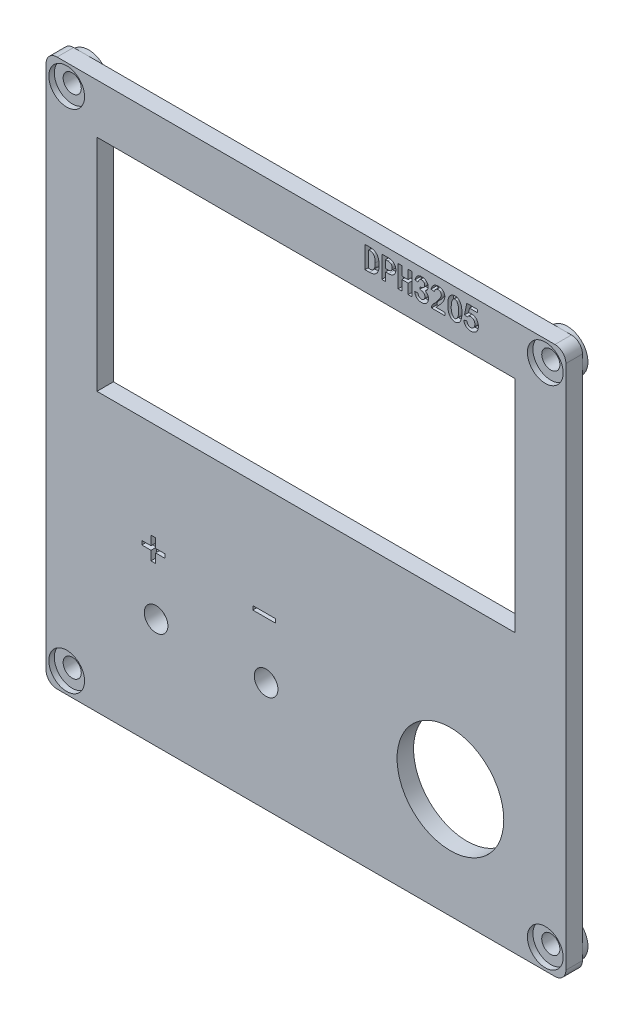
from build123d import *

# Parameters (mm, degrees)
SKETCH_1_R          = 2.15
SKETCH_1_R_2        = 9.7
SKETCH_1_W          = 76
SKETCH_1_H          = 40
EXTRUDE_1_DEPTH     = 3
SKETCH_2_W          = 4.137797811
SKETCH_2_H          = 0.710882164
CUT_EXTRUDE_1_DEPTH = 1
SKETCH_3_R          = 3.75
EXTRUDE_2_DEPTH     = 1
SKETCH_4_R          = 1.65
CUT_EXTRUDE_2_DEPTH = 69.72863319
SKETCH_5_R          = 3.25
CUT_EXTRUDE_3_DEPTH = 1


with BuildPart() as part:
    # 草图1 → 凸台-拉伸1 (new body)
    with BuildSketch(Plane.XY):
        with BuildLine():
            Line((-45.25, -49.75), (45.25, -49.75))
            ThreePointArc((45.25, -49.75), (46.664213562, -49.164213562), (47.25, -47.75))
            Line((47.25, -47.75), (47.25, 47.75))
            ThreePointArc((47.25, 47.75), (46.664213562, 49.164213562), (45.25, 49.75))
            Line((45.25, 49.75), (-45.25, 49.75))
            ThreePointArc((-45.25, 49.75), (-46.664213562, 49.164213562), (-47.25, 47.75))
            Line((-47.25, 47.75), (-47.25, -47.75))
            ThreePointArc((-47.25, -47.75), (-46.664213562, -49.164213562), (-45.25, -49.75))
        make_face()
        with Locations((-27.25, -29.75)):
            Circle(SKETCH_1_R, mode=Mode.SUBTRACT)
        with Locations((-7.25, -29.75)):
            Circle(SKETCH_1_R, mode=Mode.SUBTRACT)
        with Locations((26.25, -29.75)):
            Circle(SKETCH_1_R_2, mode=Mode.SUBTRACT)
        with Locations((0, 20.75)):
            Rectangle(SKETCH_1_W, SKETCH_1_H, mode=Mode.SUBTRACT)
    extrude(amount=EXTRUDE_1_DEPTH)

    # 草图2 → 切除-拉伸1 (cut)
    # profile 1 of 9: a face of its own
    with BuildSketch(Plane.XY.offset(3)):
        with BuildLine():
            add(Edge.make_bspline(
                [(25.773758367, 46.505328525), (25.775969709, 46.555147397), (25.78028274, 46.652314757), (25.792643094, 46.793720271), (25.807811887, 46.927506481), (25.827234123, 47.053324063), (25.851527714, 47.171241352), (25.878621466, 47.281438374), (25.910258204, 47.383865297), (25.958071695, 47.508706729), (26.028073633, 47.65355075), (26.129838409, 47.812915081), (26.249373739, 47.956068284), (26.361427404, 48.062917846), (26.459859694, 48.137856014), (26.539050196, 48.187020162), (26.623405238, 48.228229653), (26.712377362, 48.261567945), (26.805561652, 48.288572609), (26.903860095, 48.307274167), (27.006946072, 48.318309436), (27.113386993, 48.321492741), (27.220523142, 48.317648244), (27.325149694, 48.299647225), (27.426333108, 48.272415435), (27.523724912, 48.23356352), (27.617020335, 48.183418171), (27.705974966, 48.121730736), (27.791206089, 48.049115977), (27.872032503, 47.966443402), (27.946529479, 47.875359078), (28.017067085, 47.780694437), (28.077305495, 47.679174353), (28.133000891, 47.574821135), (28.179768948, 47.464746766), (28.221878796, 47.35086003), (28.253542284, 47.230979038), (28.289719702, 47.063498275), (28.319887216, 46.841890265), (28.342221295, 46.562137879), (28.348624342, 46.264320492), (28.340737918, 46.006845206), (28.326531135, 45.798207482), (28.310482089, 45.646366882), (28.288556953, 45.501864688), (28.263873867, 45.363943398), (28.230439156, 45.23364898), (28.193993631, 45.10964595), (28.152076056, 44.992861191), (28.104678237, 44.883230969), (28.05213051, 44.780496547), (27.990371895, 44.686222656), (27.921958927, 44.599748852), (27.846666976, 44.520638651), (27.763766457, 44.449935675), (27.673294119, 44.387250387), (27.575816856, 44.332224167), (27.472861073, 44.285167849), (27.36614023, 44.248577337), (27.258979427, 44.222399489), (27.152163404, 44.208670953), (27.045937061, 44.20572628), (26.940309689, 44.215496424), (26.835177704, 44.2361569), (26.731193601, 44.269237737), (26.629037036, 44.312736289), (26.531987609, 44.365043186), (26.440383588, 44.420585111), (26.356701959, 44.480730209), (26.28118794, 44.545618287), (26.211755205, 44.612929848), (26.151672362, 44.686044277), (26.097640965, 44.762044244), (26.039569231, 44.870531569), (25.976248246, 45.009582451), (25.912056748, 45.180745354), (25.85808123, 45.35509476), (25.824800149, 45.504726549), (25.802464788, 45.629516835), (25.790263573, 45.731610409), (25.779644583, 45.841503623), (25.773230384, 45.959230052), (25.768976816, 46.08460339), (25.767102405, 46.217713298), (25.769107518, 46.358830641), (25.772177634, 46.455536739), (25.773758367, 46.505328525)],
                knots=[0, 0, 0, 0, 1.155683737, 2.254060208, 3.289083543, 4.275996313, 5.203501349, 6.078654409, 6.905254226, 7.686259293, 9.175480835, 10.625362805, 12.057229327, 13.488373587, 14.203415217, 14.921281653, 15.645099004, 16.375632236, 17.120922195, 17.891035316, 18.691651653, 19.521200253, 20.357904477, 21.171386448, 21.975949703, 22.782724614, 23.595854961, 24.425642192, 25.286833663, 26.187407587, 27.101221321, 28.01267284, 28.920448357, 29.83426209, 30.752254981, 31.690137756, 32.645956503, 33.622989927, 35.660431351, 37.823041574, 40.125301952, 42.560703798, 43.790833543, 44.971618186, 46.098231705, 47.178004829, 48.217249088, 49.214075701, 50.172927633, 51.090920525, 51.980953586, 52.843803822, 53.698431003, 54.533503556, 55.370943622, 56.21918914, 57.080584939, 57.962199368, 58.839009869, 59.691678548, 60.51441043, 61.330511274, 62.149625556, 62.967853103, 63.80909348, 64.673955469, 65.537417366, 66.362178841, 67.155619074, 67.922554923, 68.668316995, 69.393591698, 70.113049857, 70.825595159, 72.241347001, 73.651946307, 75.059845092, 76.467821999, 77.201720101, 77.997292311, 78.850038385, 79.760306499, 80.729291287, 81.757490875, 82.845382708, 84, 84, 84, 84], degree=3))
        make_face()
        with BuildLine():
            add(Edge.make_bspline(
                [(26.41509771, 46.636687186), (26.410165106, 46.585487328), (26.400476242, 46.484918041), (26.392201304, 46.33572282), (26.387876527, 46.19080666), (26.392312663, 46.050219507), (26.398966837, 45.913761834), (26.414043524, 45.782047153), (26.433830158, 45.654311536), (26.458059753, 45.531807031), (26.488276758, 45.416206016), (26.521468133, 45.309323189), (26.557380799, 45.211249156), (26.59736876, 45.123027902), (26.641451804, 45.044114897), (26.688547916, 44.97459924), (26.738281787, 44.913312011), (26.792544689, 44.862927743), (26.848364897, 44.821316698), (26.905215929, 44.789259165), (26.962359574, 44.766437831), (27.019979655, 44.753170966), (27.078314302, 44.749657478), (27.136986281, 44.756149113), (27.196285597, 44.770529558), (27.254563841, 44.796176626), (27.311436858, 44.829485722), (27.366424787, 44.869793435), (27.415834334, 44.919582698), (27.46269417, 44.97568869), (27.50553198, 45.039712753), (27.544919173, 45.11091034), (27.580297618, 45.189959669), (27.622276756, 45.306268798), (27.665555628, 45.4617722), (27.703450078, 45.656969482), (27.725582549, 45.861453971), (27.731834948, 46.071718898), (27.729599297, 46.281590487), (27.722491719, 46.484800812), (27.712611199, 46.678373121), (27.697920649, 46.862437574), (27.674674905, 47.037543403), (27.634162425, 47.202873635), (27.577482221, 47.3577924), (27.517488775, 47.478120074), (27.462791153, 47.56536967), (27.419765216, 47.623154318), (27.37345661, 47.671545013), (27.325938432, 47.713322683), (27.275020824, 47.745046871), (27.221804213, 47.768627401), (27.166358108, 47.784438549), (27.108992325, 47.791110861), (27.051120902, 47.789457516), (26.994094684, 47.77906452), (26.938124506, 47.759887967), (26.883859036, 47.730891663), (26.830409045, 47.693569323), (26.77795796, 47.647879341), (26.727069625, 47.592989371), (26.677356181, 47.529473969), (26.629533656, 47.456150099), (26.587202958, 47.371127633), (26.547238137, 47.275897154), (26.514222271, 47.168769499), (26.48132146, 47.051798414), (26.456054589, 46.922991706), (26.432189797, 46.783682654), (26.42092889, 46.686836533), (26.41509771, 46.636687186)],
                knots=[0, 0, 0, 0, 1.452167118, 2.852418281, 4.218396657, 5.543984443, 6.822765002, 8.074713207, 9.284974616, 10.471920825, 11.598846593, 12.656922723, 13.631044256, 14.5458853, 15.388812111, 16.179953707, 16.914519434, 17.61197034, 18.264888641, 18.876285569, 19.449485096, 19.996394829, 20.5387489, 21.091123116, 21.657504393, 22.254856762, 22.881287043, 23.51641241, 24.173517405, 24.856351225, 25.578003657, 26.344795291, 27.151303469, 28.020468383, 29.834110771, 31.702512638, 33.62906866, 35.634339229, 37.638355807, 39.554512999, 41.375197988, 43.110520322, 44.767505055, 46.356911141, 47.906083104, 49.416608493, 50.142950543, 50.812019548, 51.446476334, 52.031067659, 52.593805832, 53.132839029, 53.670052187, 54.215287947, 54.756919201, 55.298972215, 55.845822252, 56.420500712, 57.030186539, 57.683154838, 58.380605745, 59.14033988, 59.958423015, 60.847419337, 61.818318184, 62.871135914, 64.010020701, 65.247701822, 66.574791078, 68, 68, 68, 68], degree=3))
        make_face(mode=Mode.SUBTRACT)
    # profile 2 of 9: a face of its own
    with BuildSketch(Plane.XY.offset(3)):
        with BuildLine():
            add(Edge.make_bspline(
                [(13.285241518, 46.240035544), (13.283682115, 46.155285074), (13.280668639, 45.991508663), (13.259812953, 45.754935684), (13.22273555, 45.536896219), (13.173073162, 45.336448602), (13.106910902, 45.154244072), (13.026293325, 44.99020749), (12.931485953, 44.843811701), (12.820659608, 44.716773682), (12.696286472, 44.607755406), (12.563161093, 44.51142845), (12.418082939, 44.431513034), (12.263072893, 44.364668391), (12.096315889, 44.314857921), (11.919536629, 44.27743285), (11.731770227, 44.25631633), (11.603099923, 44.25321417), (11.537226923, 44.251626014)],
                knots=[0, 0, 0, 0, 1.342144575, 2.593633054, 3.756717374, 4.841651051, 5.859627, 6.82036316, 7.730462365, 8.613865072, 9.480661094, 10.344703869, 11.211025818, 12.098326216, 13.012995588, 13.962311034, 14.956801371, 16, 16, 16, 16], degree=3))
            Line((11.537226923, 44.251626014), (10.708722952, 44.251626014))
            Line((10.708722952, 44.251626014), (10.708722952, 48.251626014))
            Line((10.708722952, 48.251626014), (11.537226923, 48.251626014))
            add(Edge.make_bspline(
                [(11.537226923, 48.251626014), (11.610260238, 48.250152136), (11.751820851, 48.247295317), (11.956676316, 48.225090944), (12.146366, 48.187602682), (12.320852916, 48.135495871), (12.480414228, 48.068439758), (12.624969787, 47.985881101), (12.753924652, 47.887279685), (12.867888749, 47.773205371), (12.967800644, 47.642938015), (13.052548693, 47.494253787), (13.12560502, 47.328943544), (13.184776317, 47.145345933), (13.229402626, 46.944031425), (13.26162354, 46.725110145), (13.281461748, 46.48852175), (13.283952355, 46.324786503), (13.285241518, 46.240035544)],
                knots=[0, 0, 0, 0, 1.139218849, 2.20815003, 3.209846182, 4.151949686, 5.044228713, 5.904257272, 6.741881979, 7.569029454, 8.412913495, 9.295104618, 10.232584117, 11.227981957, 12.299195142, 13.445861256, 14.677952907, 16, 16, 16, 16], degree=3))
        make_face()
        with BuildLine():
            add(Edge.make_bspline(
                [(12.574359354, 46.240035544), (12.573549734, 46.306164867), (12.57199564, 46.433102252), (12.559864164, 46.615622808), (12.540805925, 46.782578834), (12.512892596, 46.934201333), (12.476157586, 47.070344041), (12.4320268, 47.191100107), (12.379864709, 47.296547246), (12.318068244, 47.38635609), (12.247965414, 47.46285518), (12.171239802, 47.529860091), (12.08537177, 47.586000977), (11.991202509, 47.631481211), (11.88917519, 47.666818632), (11.779119259, 47.691264389), (11.66103836, 47.707233513), (11.579351112, 47.708978836), (11.537226923, 47.709878858)],
                knots=[0, 0, 0, 0, 1.535002912, 2.946487986, 4.244348877, 5.43397676, 6.521824758, 7.513996585, 8.414230777, 9.245329631, 10.035428857, 10.817273383, 11.604069902, 12.409274804, 13.239177928, 14.104616871, 15.02259556, 16, 16, 16, 16], degree=3))
            Line((11.537226923, 47.709878858), (11.396424175, 47.709878858))
            Line((11.396424175, 47.709878858), (11.396424175, 44.79337317))
            Line((11.396424175, 44.79337317), (11.537226923, 44.79337317))
            add(Edge.make_bspline(
                [(11.537226923, 44.79337317), (11.579344288, 44.794347045), (11.66098203, 44.796234747), (11.779335594, 44.811216162), (11.889744031, 44.834562761), (11.99159878, 44.869176125), (12.085536319, 44.913032061), (12.17094767, 44.967647772), (12.248752448, 45.031374777), (12.318834537, 45.105681961), (12.380934193, 45.193019115), (12.432859029, 45.296288209), (12.476092639, 45.41526561), (12.513071508, 45.549530777), (12.540773279, 45.700073783), (12.559878509, 45.86615988), (12.571993635, 46.047827474), (12.573548952, 46.174192627), (12.574359354, 46.240035544)],
                knots=[0, 0, 0, 0, 0.985268004, 1.909783609, 2.787259994, 3.621665962, 4.421521346, 5.207376589, 5.987676396, 6.769383106, 7.590706022, 8.48624322, 9.465232296, 10.548914331, 11.741531606, 13.043184133, 14.459342799, 16, 16, 16, 16], degree=3))
        make_face(mode=Mode.SUBTRACT)
    # profile 3 of 9: a face of its own
    with BuildSketch(Plane.XY.offset(3)):
        with BuildLine():
            add(Edge.make_bspline(
                [(16.329671653, 47.013592101), (16.328806119, 46.968605593), (16.327107643, 46.880326519), (16.310133088, 46.751375346), (16.284075298, 46.628724295), (16.246005839, 46.513164938), (16.197560034, 46.404236552), (16.139240793, 46.301371071), (16.06887224, 46.205508952), (15.988432171, 46.116506701), (15.898521193, 46.035598708), (15.798916655, 45.965374644), (15.68972746, 45.906889173), (15.571635008, 45.858986945), (15.444923381, 45.8209571), (15.309138478, 45.794921736), (15.164754445, 45.778066366), (15.065358552, 45.77640862), (15.01436794, 45.775558188)],
                knots=[0, 0, 0, 0, 1.055941234, 2.072121589, 3.048957332, 3.996857081, 4.923552649, 5.844699312, 6.768221172, 7.710385292, 8.657546142, 9.602916946, 10.565193964, 11.559900134, 12.591170482, 13.666713964, 14.803012066, 16, 16, 16, 16], degree=3))
            Line((15.01436794, 45.775558188), (14.464035251, 45.775558188))
            Line((14.464035251, 45.775558188), (14.464035251, 44.251626014))
            Line((14.464035251, 44.251626014), (13.776334027, 44.251626014))
            Line((13.776334027, 44.251626014), (13.776334027, 48.251626014))
            Line((13.776334027, 48.251626014), (15.01436794, 48.251626014))
            add(Edge.make_bspline(
                [(15.01436794, 48.251626014), (15.065358459, 48.250775176), (15.164754169, 48.24911664), (15.309139492, 48.232266867), (15.444919861, 48.206211821), (15.571393321, 48.16832709), (15.689323223, 48.120264803), (15.797824013, 48.060813767), (15.897699579, 47.990787048), (15.987547151, 47.909793342), (16.068081752, 47.820858618), (16.138225908, 47.724699681), (16.197735386, 47.622354254), (16.245939904, 47.513123531), (16.284100665, 47.397612587), (16.310039712, 47.275221892), (16.327161825, 47.146580039), (16.3288226, 47.058580774), (16.329671653, 47.013592101)],
                knots=[0, 0, 0, 0, 1.197461093, 2.334208364, 3.410176999, 4.441854999, 5.43073401, 6.396602736, 7.342347237, 8.289882492, 9.232419041, 10.156305961, 11.081170954, 12.008232837, 12.956507283, 13.93372916, 14.943641362, 16, 16, 16, 16], degree=3))
        make_face()
        with BuildLine():
            add(Edge.make_bspline(
                [(15.64197043, 47.013592101), (15.64167773, 47.045959339), (15.641114234, 47.108271506), (15.631250111, 47.197481465), (15.616825916, 47.278714862), (15.597665845, 47.352440408), (15.571114529, 47.417980744), (15.538387259, 47.475120916), (15.50023693, 47.524371351), (15.455388593, 47.565178288), (15.40481494, 47.600096416), (15.347417164, 47.628677232), (15.284866641, 47.654842386), (15.215494445, 47.675363293), (15.139850619, 47.690364977), (15.058129368, 47.701417981), (14.970127036, 47.708352746), (14.909351534, 47.709357961), (14.877857959, 47.709878858)],
                knots=[0, 0, 0, 0, 1.287087184, 2.477851002, 3.56551051, 4.568137571, 5.502703185, 6.369845782, 7.180743627, 7.970419851, 8.772637866, 9.617977299, 10.516617182, 11.467615524, 12.490341929, 13.582105939, 14.747058877, 16, 16, 16, 16], degree=3))
            Line((14.877857959, 47.709878858), (14.464035251, 47.709878858))
            Line((14.464035251, 47.709878858), (14.464035251, 46.318163897))
            Line((14.464035251, 46.318163897), (14.877857959, 46.318163897))
            add(Edge.make_bspline(
                [(14.877857959, 46.318163897), (14.909350441, 46.318695819), (14.970409155, 46.319727126), (15.058709899, 46.3265609), (15.140696737, 46.337710851), (15.21639406, 46.352580653), (15.285484277, 46.373499153), (15.348313312, 46.398061846), (15.40494137, 46.427407508), (15.455410119, 46.461960691), (15.500231043, 46.502825219), (15.538388973, 46.552059685), (15.571114017, 46.609204533), (15.597665998, 46.674743473), (15.61682587, 46.748469436), (15.631250125, 46.829702708), (15.64111423, 46.918912704), (15.641677728, 46.981224866), (15.64197043, 47.013592101)],
                knots=[0, 0, 0, 0, 1.253177668, 2.4297043, 3.521674426, 4.544593913, 5.495771796, 6.390314524, 7.225705931, 8.028075398, 8.817900706, 9.628951643, 10.496257949, 11.431000001, 12.433816351, 13.5216812, 14.712669824, 16, 16, 16, 16], degree=3))
        make_face(mode=Mode.SUBTRACT)
    # profile 4 of 9: a face of its own
    with BuildSketch(Plane.XY.offset(3)):
        Polygon((19.260772748, 44.251626014), (18.573071524, 44.251626014), (18.573071524, 46.07175909), (17.440639672, 46.07175909), (17.440639672, 44.251626014), (16.752938449, 44.251626014), (16.752938449, 48.251626014), (17.440639672, 48.251626014), (17.440639672, 46.613506246), (18.573071524, 46.613506246), (18.573071524, 48.251626014), (19.260772748, 48.251626014), align=None)
    # profile 5 of 9: a face of its own
    with BuildSketch(Plane.XY.offset(3)):
        with BuildLine():
            Line((19.751865257, 45.352291393), (20.303915053, 45.430419746))
            add(Edge.make_bspline(
                [(20.303915053, 45.430419746), (20.322527897, 45.376460329), (20.357887277, 45.273952002), (20.426144056, 45.133940589), (20.503365858, 45.015634424), (20.575355936, 44.931661448), (20.638782126, 44.877911171), (20.687663423, 44.84326029), (20.739493325, 44.814707903), (20.794065521, 44.792432205), (20.851246549, 44.775092948), (20.911027357, 44.763102805), (20.973732907, 44.757073049), (21.037815362, 44.75726895), (21.102064811, 44.762785539), (21.164109097, 44.776071041), (21.223704826, 44.794546264), (21.279697156, 44.820709477), (21.33275333, 44.852822425), (21.382775849, 44.891533337), (21.429027941, 44.937652945), (21.472498497, 44.988700856), (21.51171804, 45.044064122), (21.54541632, 45.102277643), (21.572000201, 45.163263993), (21.593649768, 45.2257636), (21.60910437, 45.290469168), (21.618573836, 45.356861999), (21.621930306, 45.425250114), (21.619382033, 45.49476754), (21.610881373, 45.563391392), (21.597247592, 45.628923734), (21.578360894, 45.690593788), (21.553549558, 45.74831901), (21.522212256, 45.802064303), (21.485296973, 45.851831342), (21.4429354, 45.897532753), (21.394923886, 45.939749217), (21.338639819, 45.977614843), (21.274167091, 46.014175221), (21.198779264, 46.045817155), (21.114860117, 46.077189382), (21.020825599, 46.104085407), (20.917696519, 46.128905767), (20.804852417, 46.151317002), (20.72608998, 46.163365679), (20.685112735, 46.16963417)],
                knots=[0, 0, 0, 0, 2.21924101, 4.215958907, 6.040992817, 7.7053072, 8.495104242, 9.27040691, 10.032811151, 10.791629887, 11.559461714, 12.354265444, 13.159682002, 14.005854253, 14.844521828, 15.663370554, 16.46971005, 17.266772081, 18.061107775, 18.878441235, 19.720869505, 20.597620065, 21.484212586, 22.356995289, 23.209370964, 24.068482601, 24.927233434, 25.793243368, 26.673943911, 27.587530034, 28.496218265, 29.360938961, 30.188521517, 31.001368487, 31.799596098, 32.603472073, 33.407116705, 34.21988742, 35.084608115, 36.041665591, 37.098677481, 38.261085067, 39.525891865, 40.900414571, 42.387397877, 44, 44, 44, 44], degree=3))
            Line((20.685112735, 46.16963417), (20.685112735, 46.562851599))
            add(Edge.make_bspline(
                [(20.685112735, 46.562851599), (20.725812533, 46.566951134), (20.804345719, 46.574861483), (20.916916171, 46.594044211), (21.020171393, 46.616955759), (21.113855562, 46.644024174), (21.197941264, 46.676026146), (21.272699478, 46.711579511), (21.338296413, 46.751930391), (21.393327612, 46.798257558), (21.441591196, 46.847206094), (21.480534653, 46.901225645), (21.515224357, 46.957060153), (21.540391325, 47.017565156), (21.559798937, 47.08106698), (21.571489359, 47.147955425), (21.576667948, 47.218421336), (21.57470773, 47.290830965), (21.566948359, 47.362948577), (21.55007106, 47.430948714), (21.528284025, 47.494545431), (21.497753116, 47.55240176), (21.460574356, 47.605243257), (21.416324173, 47.653163772), (21.364425562, 47.694916823), (21.307089514, 47.731659985), (21.246309478, 47.762096153), (21.183795552, 47.785397606), (21.121233185, 47.802352932), (21.057641364, 47.809699831), (20.994085545, 47.810520265), (20.92965385, 47.804959816), (20.865475333, 47.789427564), (20.800038032, 47.768838572), (20.735804957, 47.735465955), (20.67276126, 47.689076343), (20.613477454, 47.627298757), (20.555378599, 47.552476926), (20.500361872, 47.463653434), (20.445795024, 47.361451425), (20.393945616, 47.245129984), (20.362965719, 47.161736455), (20.34684272, 47.118335608)],
                knots=[0, 0, 0, 0, 1.544655138, 2.980523068, 4.310085624, 5.538041238, 6.660247671, 7.704521267, 8.661264608, 9.559490368, 10.415691744, 11.250192615, 12.06957472, 12.892798034, 13.716943409, 14.573554092, 15.451518492, 16.381382685, 17.306522728, 18.184819779, 19.022465106, 19.839562419, 20.646298093, 21.457079029, 22.294445327, 23.155002605, 24.02514668, 24.85635064, 25.671730158, 26.466794538, 27.266766995, 28.070237254, 28.901511498, 29.756073687, 30.655274543, 31.621678213, 32.699429876, 33.87785843, 35.19439462, 36.640317884, 38.251506453, 40, 40, 40, 40], degree=3))
            Line((20.34684272, 47.118335608), (19.797368584, 47.196463962))
            add(Edge.make_bspline(
                [(19.797368584, 47.196463962), (19.809239482, 47.235816237), (19.832566992, 47.313147415), (19.874227902, 47.424250762), (19.917812171, 47.529602096), (19.965103325, 47.628469239), (20.015638403, 47.721458083), (20.06997827, 47.808003584), (20.126165903, 47.889441874), (20.187759361, 47.963403573), (20.252665616, 48.03205765), (20.324427508, 48.092427734), (20.402334197, 48.144965642), (20.485631487, 48.190512521), (20.574717933, 48.228616914), (20.669755236, 48.258331904), (20.770432139, 48.281800881), (20.875918338, 48.296474854), (20.982580733, 48.3051184), (21.087809443, 48.30663585), (21.190210064, 48.302706107), (21.28977884, 48.291550541), (21.386256282, 48.273662), (21.479338715, 48.248344895), (21.569889341, 48.217593356), (21.656949772, 48.180117772), (21.738895303, 48.136477806), (21.815187368, 48.088252857), (21.884655518, 48.035034111), (21.947965698, 47.977345495), (22.004028953, 47.914312176), (22.053320914, 47.846180064), (22.095135635, 47.772753509), (22.131419489, 47.695640996), (22.16003099, 47.61527674), (22.183194708, 47.533088783), (22.196972044, 47.448684641), (22.206256304, 47.362969551), (22.206607991, 47.275344026), (22.200743541, 47.186370711), (22.18739375, 47.095487764), (22.168388673, 47.00362617), (22.140317229, 46.912388801), (22.101650354, 46.824222569), (22.051284759, 46.740649056), (21.990529759, 46.661189674), (21.91963906, 46.585446861), (21.838673163, 46.513276581), (21.747011889, 46.444900285), (21.680250055, 46.4043288), (21.64583392, 46.383413951)],
                knots=[0, 0, 0, 0, 1.264664845, 2.485193632, 3.649815651, 4.772554787, 5.8564488, 6.904873161, 7.916470085, 8.89869285, 9.86418825, 10.820480558, 11.778069864, 12.751606364, 13.738084608, 14.754768136, 15.81232734, 16.915902724, 18.029136064, 19.103794268, 20.152810375, 21.180875043, 22.184503936, 23.16940822, 24.147039655, 25.125424593, 26.08285187, 27.001536872, 27.899944066, 28.772641487, 29.633525806, 30.491521848, 31.355643938, 32.230383382, 33.110780052, 33.97826197, 34.85428633, 35.739428161, 36.629028292, 37.54707979, 38.481255219, 39.453795203, 40.431585318, 41.413492129, 42.408894417, 43.427064688, 44.486456052, 45.596758908, 46.761114469, 48, 48, 48, 48], degree=3))
            add(Edge.make_bspline(
                [(21.64583392, 46.383413951), (21.670582827, 46.373146404), (21.719451451, 46.35287234), (21.789976856, 46.317014014), (21.854754808, 46.273243025), (21.917436744, 46.226205881), (21.975254215, 46.17283043), (22.030409082, 46.114814186), (22.080301223, 46.0505461), (22.127019597, 45.981749988), (22.168673238, 45.908150229), (22.202109327, 45.828216535), (22.228647467, 45.743451125), (22.247638347, 45.653467999), (22.258328344, 45.558620934), (22.262858503, 45.458767222), (22.25877886, 45.353801374), (22.248986298, 45.245310861), (22.231005052, 45.136385427), (22.201194171, 45.03105872), (22.162946892, 44.930041543), (22.113263088, 44.834330754), (22.054854888, 44.743065268), (21.98667074, 44.656522955), (21.907725487, 44.575952013), (21.821162666, 44.499852774), (21.72707686, 44.432280678), (21.630380815, 44.371548198), (21.529744081, 44.321247441), (21.425867751, 44.281169371), (21.31913788, 44.249699544), (21.209167193, 44.22965671), (21.09640518, 44.2169563), (20.981497081, 44.216051105), (20.867247772, 44.222434116), (20.756239223, 44.2381919), (20.649251722, 44.260968087), (20.546902545, 44.293148588), (20.448368539, 44.332387319), (20.354600439, 44.38120836), (20.264070949, 44.436524635), (20.178982958, 44.501542883), (20.098276542, 44.574106071), (20.026465517, 44.65802394), (19.961630749, 44.750692786), (19.904001004, 44.852378721), (19.853959626, 44.9638923), (19.812722177, 45.085154851), (19.77675534, 45.215171784), (19.76030962, 45.305771351), (19.751865257, 45.352291393)],
                knots=[0, 0, 0, 0, 0.768138437, 1.516748496, 2.263152186, 3.006528408, 3.761540595, 4.516106847, 5.299044825, 6.090959292, 6.899030075, 7.718886061, 8.570043758, 9.442217001, 10.351016586, 11.303647327, 12.305160512, 13.359969178, 14.42557193, 15.464691966, 16.493198161, 17.516980995, 18.550254108, 19.59586457, 20.669303552, 21.779974798, 22.895936785, 23.986546903, 25.050632422, 26.115666464, 27.175060169, 28.23550182, 29.31644003, 30.424198195, 31.525587691, 32.594249943, 33.6354733, 34.657940217, 35.666553097, 36.671990709, 37.685198356, 38.704235937, 39.737964997, 40.790761429, 41.862851258, 42.976186133, 44.136653187, 45.361383937, 46.645153232, 48, 48, 48, 48], degree=3))
        make_face()
    # profile 6 of 9: a face of its own
    with BuildSketch(Plane.XY.offset(3)):
        with BuildLine():
            add(Edge.make_bspline(
                [(22.819476332, 44.423336681), (22.822214596, 44.453206146), (22.82768775, 44.512908261), (22.848307906, 44.60012257), (22.875620948, 44.685491813), (22.912698547, 44.767712356), (22.958646447, 44.847222256), (23.013108507, 44.923825472), (23.075923691, 44.998043266), (23.1489916, 45.069181292), (23.228255981, 45.143518527), (23.31093372, 45.227492165), (23.397949564, 45.320796087), (23.489769179, 45.423035901), (23.586392017, 45.534238171), (23.68714147, 45.654978067), (23.792926502, 45.785003072), (23.901180239, 45.920670206), (24.006603986, 46.057129952), (24.104204284, 46.188428094), (24.192990531, 46.310583868), (24.270506003, 46.425355104), (24.338268838, 46.531622594), (24.396957347, 46.629224789), (24.445440054, 46.718449284), (24.494689949, 46.823686839), (24.540304453, 46.944657022), (24.578130085, 47.080422898), (24.593895422, 47.204917282), (24.588615055, 47.318209287), (24.562715796, 47.420133148), (24.522585294, 47.51363447), (24.462488763, 47.595746412), (24.389061934, 47.667393581), (24.305512395, 47.725504742), (24.214292043, 47.765494672), (24.117943114, 47.784708338), (24.018303963, 47.782931083), (23.918081324, 47.764343267), (23.818007454, 47.731349927), (23.719570869, 47.682286952), (23.63958032, 47.630038284), (23.576841643, 47.579774072), (23.532247319, 47.533217894), (23.488555493, 47.481285838), (23.446984623, 47.422082699), (23.407758741, 47.355891167), (23.370309713, 47.282906712), (23.333720016, 47.203451231), (23.312245733, 47.147375689), (23.301124755, 47.118335608)],
                knots=[0, 0, 0, 0, 0.812458924, 1.623916483, 2.423975288, 3.240316732, 4.06429525, 4.910522612, 5.785959881, 6.696898735, 7.673935193, 8.733053017, 9.891570135, 11.133511023, 12.459304827, 13.886182053, 15.39761038, 17.004732369, 18.59270287, 20.073435524, 21.441110431, 22.687384008, 23.828405559, 24.858552289, 25.775225142, 26.580685755, 28.007647397, 29.276407073, 30.393989518, 31.396581679, 32.332049695, 33.231912994, 34.138577372, 35.071531117, 36.003612958, 36.883031381, 37.753604976, 38.646109437, 39.568611226, 40.508543129, 41.494232884, 42.542490605, 43.093985918, 43.670208311, 44.28726261, 44.933214355, 45.629294362, 46.372086978, 47.156945713, 48, 48, 48, 48], degree=3))
            Line((23.301124755, 47.118335608), (22.728469679, 47.196463962))
            add(Edge.make_bspline(
                [(22.728469679, 47.196463962), (22.744267635, 47.24501027), (22.774819914, 47.338895852), (22.827688554, 47.472579161), (22.883368928, 47.595600866), (22.941974509, 47.708162807), (23.004996168, 47.808867792), (23.070267618, 47.899309233), (23.139733681, 47.978177759), (23.212402866, 48.046993333), (23.28934976, 48.105687848), (23.368572037, 48.1581106), (23.45172664, 48.202892171), (23.537644554, 48.241143476), (23.627623986, 48.27069012), (23.720336031, 48.295269822), (23.81693379, 48.31153556), (23.882599463, 48.316790776), (23.915848944, 48.319451728)],
                knots=[0, 0, 0, 0, 1.394098335, 2.696100676, 3.923911207, 5.081226417, 6.159164946, 7.166006065, 8.124123657, 9.025463167, 9.894746418, 10.764099952, 11.617494181, 12.471460966, 13.329175664, 14.201265779, 15.089220005, 16, 16, 16, 16], degree=3))
            add(Edge.make_bspline(
                [(23.915848944, 48.319451728), (23.955029812, 48.322567863), (24.032165767, 48.328702646), (24.146372835, 48.328482018), (24.256537562, 48.320858676), (24.363850632, 48.305674995), (24.469590993, 48.279810774), (24.575385014, 48.241334879), (24.681747204, 48.19045509), (24.787915144, 48.12737247), (24.890206836, 48.050977966), (24.982992956, 47.958123294), (25.063702295, 47.849618641), (25.133466532, 47.727888309), (25.188291159, 47.592281861), (25.222643798, 47.443447676), (25.234267923, 47.28247802), (25.228922987, 47.141237571), (25.212633071, 47.021638534), (25.189504439, 46.926257623), (25.158723716, 46.826275854), (25.117494582, 46.722334398), (25.069094214, 46.613312018), (25.009676541, 46.500777491), (24.94304756, 46.38297191), (24.865067812, 46.259465102), (24.774569565, 46.125693415), (24.665414279, 45.980477865), (24.54019287, 45.818470559), (24.395679697, 45.642519784), (24.234379876, 45.450441459), (24.053401904, 45.245160165), (23.856404999, 45.02298362), (23.716935969, 44.871828557), (23.64454609, 44.79337317)],
                knots=[0, 0, 0, 0, 0.767290437, 1.510576088, 2.227684762, 2.922405895, 3.624527997, 4.349326193, 5.116759085, 5.923767319, 6.757595258, 7.603269073, 8.477329005, 9.390943466, 10.336361207, 11.323254094, 12.360540583, 13.479157188, 14.077452175, 14.714578673, 15.39335949, 16.11880377, 16.896766127, 17.721631154, 18.602666877, 19.539239205, 20.57313278, 21.755702502, 23.085980454, 24.571542942, 26.201589399, 27.983822824, 29.915447008, 32, 32, 32, 32], degree=3))
            Line((23.64454609, 44.79337317), (25.282665858, 44.79337317))
            Line((25.282665858, 44.79337317), (25.282665858, 44.273948401))
            Line((25.282665858, 44.273948401), (22.819476332, 44.273948401))
            Line((22.819476332, 44.273948401), (22.819476332, 44.423336681))
        make_face()
    # profile 7 of 9: a face of its own
    with BuildSketch(Plane.XY.offset(3)):
        with BuildLine():
            add(Edge.make_bspline(
                [(29.233728318, 45.453600687), (29.247737974, 45.403799456), (29.274392587, 45.309048205), (29.3259343, 45.178368857), (29.379308591, 45.063812115), (29.441380905, 44.968640726), (29.505642517, 44.888829296), (29.577499914, 44.828321231), (29.6540715, 44.784380232), (29.735967471, 44.761465325), (29.81697717, 44.750906579), (29.895263673, 44.743952855), (29.970202751, 44.74543559), (30.041803702, 44.750782977), (30.109881953, 44.763429234), (30.173835929, 44.784085766), (30.235261117, 44.808051938), (30.30986516, 44.851276054), (30.395285328, 44.91275894), (30.483887248, 44.999105248), (30.556248548, 45.097002441), (30.61298615, 45.205178311), (30.654775792, 45.322070368), (30.68206031, 45.446466342), (30.696584938, 45.577114035), (30.697274408, 45.711768991), (30.684618711, 45.844499933), (30.655446259, 45.969353784), (30.611181702, 46.083490766), (30.549299937, 46.183992703), (30.476952789, 46.271636681), (30.394156154, 46.344350295), (30.301845808, 46.401035702), (30.200899547, 46.440990055), (30.093587734, 46.466314256), (29.980979952, 46.474415716), (29.864163837, 46.467076208), (29.765186755, 46.44890354), (29.685285536, 46.425659577), (29.626214009, 46.40042891), (29.568051509, 46.369291731), (29.511607679, 46.331382754), (29.456542318, 46.287383631), (29.402979213, 46.237313436), (29.351292688, 46.180232461), (29.319024531, 46.138662842), (29.302412585, 46.117262416)],
                knots=[0, 0, 0, 0, 1.537192631, 2.924645138, 4.172950761, 5.287034592, 6.295929931, 7.20786789, 8.064956688, 8.899573886, 9.716699463, 10.493344004, 11.233712164, 11.942501119, 12.62675559, 13.286166759, 13.938789652, 14.58264386, 15.843904776, 17.059411739, 18.245643967, 19.448485466, 20.678589279, 21.925530999, 23.227026748, 24.580050769, 25.922948891, 27.181997545, 28.381342405, 29.545920675, 30.675752054, 31.749220963, 32.807301153, 33.880230292, 34.963870352, 36.073362554, 37.224149094, 38.435837451, 39.057723884, 39.694624026, 40.341843349, 41.016828394, 41.713198217, 42.435647197, 43.194656643, 44, 44, 44, 44], degree=3))
            Line((29.302412585, 46.117262416), (28.795866116, 46.170492723))
            add(Edge.make_bspline(
                [(28.795866116, 46.170492723), (28.798125835, 46.180802212), (28.803595933, 46.20575837), (28.81413302, 46.249424006), (28.827198349, 46.306277089), (28.841167917, 46.37664882), (28.859368623, 46.459895439), (28.881282914, 46.555829061), (28.903836843, 46.665126155), (28.93078977, 46.786905185), (28.960337489, 46.921848886), (28.990254789, 47.070485738), (29.026443272, 47.231499204), (29.062856422, 47.405955518), (29.10238229, 47.593459782), (29.145307035, 47.793728882), (29.190992629, 48.007183609), (29.222023367, 48.153744837), (29.238021084, 48.229303627)],
                knots=[0, 0, 0, 0, 0.24057108, 0.582349894, 1.023873684, 1.570166996, 2.217595892, 2.966196822, 3.813184297, 4.761323978, 5.809238588, 6.961962194, 8.217186954, 9.57081982, 11.02423553, 12.585169261, 14.239503842, 16, 16, 16, 16], degree=3))
            Line((29.238021084, 48.229303627), (31.190371374, 48.229303627))
            Line((31.190371374, 48.229303627), (31.190371374, 47.709878858))
            Line((31.190371374, 47.709878858), (29.722245167, 47.709878858))
            add(Edge.make_bspline(
                [(29.722245167, 47.709878858), (29.713496917, 47.663778964), (29.696523745, 47.574336903), (29.669764064, 47.444426455), (29.64338084, 47.323023904), (29.616928831, 47.209842632), (29.589239038, 47.10585611), (29.562919334, 47.009716668), (29.535600941, 46.922410468), (29.516063153, 46.867298275), (29.506748279, 46.84102288)],
                knots=[0, 0, 0, 0, 1.256676802, 2.438178378, 3.552193711, 4.58399454, 5.550714312, 6.434047499, 7.253413474, 8, 8, 8, 8], degree=3))
            add(Edge.make_bspline(
                [(29.506748279, 46.84102288), (29.525425911, 46.853667805), (29.562667954, 46.878881004), (29.622494339, 46.910740493), (29.68542272, 46.937395755), (29.751422259, 46.958974948), (29.820767568, 46.974295591), (29.893096616, 46.984500227), (29.968852494, 46.989859306), (30.073953288, 46.988027074), (30.206300931, 46.975554643), (30.364247053, 46.946949429), (30.518776929, 46.899478099), (30.66855636, 46.839856401), (30.80786813, 46.768326723), (30.927263139, 46.681435049), (31.02815913, 46.585384413), (31.102409012, 46.474920898), (31.162285736, 46.361817607), (31.215219156, 46.250133106), (31.257236517, 46.138524615), (31.291298175, 46.027670776), (31.316873463, 45.914974149), (31.331527897, 45.798537366), (31.33990855, 45.678092376), (31.33739026, 45.553869193), (31.328077059, 45.426843841), (31.30547124, 45.298219988), (31.274934251, 45.167846842), (31.234200046, 45.037540442), (31.18319785, 44.910880337), (31.117240258, 44.792870092), (31.037920872, 44.684998707), (30.945111327, 44.587561607), (30.840686761, 44.499739643), (30.724706865, 44.421501252), (30.597855179, 44.35163537), (30.45992171, 44.291543085), (30.311208106, 44.24388231), (30.15189915, 44.21293323), (29.982937169, 44.199910122), (29.836936416, 44.202245221), (29.717825351, 44.214568603), (29.628514963, 44.229869305), (29.540204706, 44.252073378), (29.454091007, 44.282849848), (29.368235884, 44.317436892), (29.284813143, 44.361048607), (29.202600149, 44.411185174), (29.1205025, 44.466174047), (29.042033377, 44.531413157), (28.972001413, 44.610688474), (28.907380647, 44.700475039), (28.848652454, 44.80193692), (28.796646839, 44.915274705), (28.751465736, 45.04064852), (28.711543302, 45.177323567), (28.691855692, 45.273423416), (28.681678522, 45.323100579)],
                knots=[0, 0, 0, 0, 0.558703968, 1.114021137, 1.676538828, 2.250740009, 2.832340435, 3.434174978, 4.059780627, 4.71234648, 6.037085189, 7.350286386, 8.683183468, 10.035824363, 11.342978111, 12.55173532, 13.685234759, 14.775295779, 15.832130109, 16.857066489, 17.835806051, 18.784875571, 19.729588613, 20.695575239, 21.690601273, 22.719138875, 23.77230156, 24.843884448, 25.951797749, 27.089129695, 28.224513774, 29.329517252, 30.430347232, 31.534120828, 32.65658214, 33.805444367, 34.995875528, 36.241061519, 37.528613975, 38.85841261, 40.253203749, 41.721664277, 42.470472116, 43.219078383, 43.965665933, 44.72382088, 45.483831453, 46.257844909, 47.053365058, 47.869794771, 48.705288143, 49.574106249, 50.483548187, 51.44336999, 52.474740496, 53.569728423, 54.743712936, 56, 56, 56, 56], degree=3))
            Line((28.681678522, 45.323100579), (29.233728318, 45.453600687))
        make_face()
    # profile 8 of 9: a face of its own
    with BuildSketch(Plane.XY.offset(3)):
        Polygon((-25.674922818, -19.361696327), (-27.346526166, -19.361696327), (-27.346526166, -21.034587505), (-28.17460086, -21.034587505), (-28.17460086, -19.361696327), (-29.846204209, -19.361696327), (-29.846204209, -18.650814163), (-28.17460086, -18.650814163), (-28.17460086, -16.979210815), (-27.346526166, -16.979210815), (-27.346526166, -18.650814163), (-25.674922818, -18.650814163), align=None)
    # profile 9 of 9: a face of its own
    with BuildSketch(Plane.XY.offset(3)):
        with Locations((-7.600800521, -19.167667283)):
            Rectangle(SKETCH_2_W, SKETCH_2_H)
    extrude(amount=-CUT_EXTRUDE_1_DEPTH, mode=Mode.SUBTRACT)

    # 草图3 → 凸台-拉伸2 (add)
    with BuildSketch(Plane(origin=(0, 0, 0), x_dir=(-1, 0, 0), z_dir=(0, 0, -1))):
        with Locations((-43.5, 46)):
            Circle(SKETCH_3_R)
        with Locations((43.5, 46)):
            Circle(SKETCH_3_R)
        with Locations((43.5, -46)):
            Circle(SKETCH_3_R)
        with Locations((-43.5, -46)):
            Circle(SKETCH_3_R)
    extrude(amount=EXTRUDE_2_DEPTH)

    # 草图4 → 切除-拉伸2 (cut, through all)
    with BuildSketch(Plane(origin=(0, 0, -1), x_dir=(-1, 0, 0), z_dir=(0, 0, -1))):
        with Locations((-43.5, 46)):
            Circle(SKETCH_4_R)
        with Locations((43.5, 46)):
            Circle(SKETCH_4_R)
        with Locations((43.5, -46)):
            Circle(SKETCH_4_R)
        with Locations((-43.5, -46)):
            Circle(SKETCH_4_R)
    extrude(amount=-CUT_EXTRUDE_2_DEPTH, mode=Mode.SUBTRACT)

    # 草图5 → 切除-拉伸3 (cut)
    with BuildSketch(Plane.XY.offset(3)):
        with Locations((-43.5, 46)):
            Circle(SKETCH_5_R)
        with Locations((43.5, 46)):
            Circle(SKETCH_5_R)
        with Locations((43.5, -46)):
            Circle(SKETCH_5_R)
        with Locations((-43.5, -46)):
            Circle(SKETCH_5_R)
    extrude(amount=-CUT_EXTRUDE_3_DEPTH, mode=Mode.SUBTRACT)


solid = part.part
